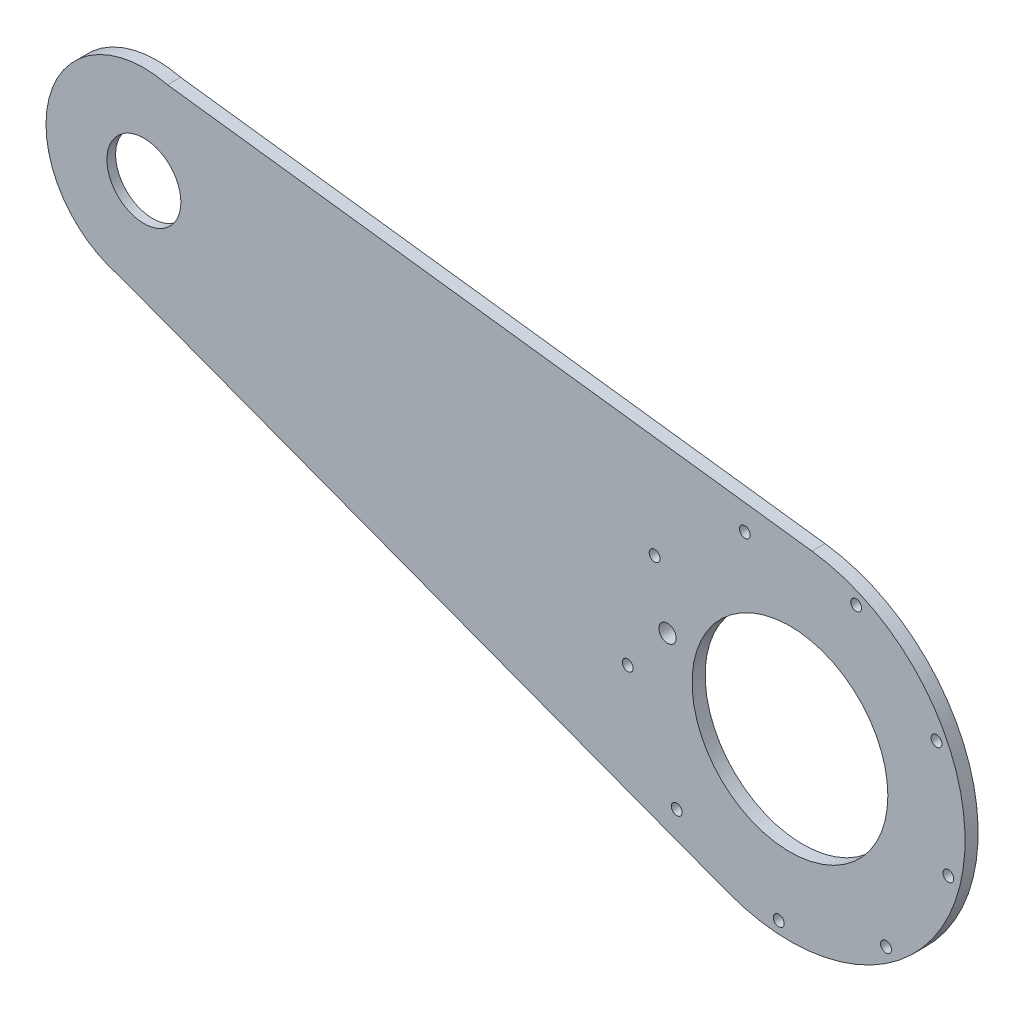
from build123d import *

# Parameters (mm, degrees)
SKETCH_2_R         = 11.5
SKETCH_2_R_2       = 22.5
SKETCH_2_R_3       = 2
EXTRUDE_1_DEPTH    = 3
EXTRUDE_START      = 1
SKETCH_2_3_R       = 11.5
SKETCH_2_3_R_2     = 8.5
EXTRUDE_2_DEPTH    = 2
HOLE_WIZARD_M3_1_D = 2.5


with BuildPart() as part:
    # 草图2 → 凸台-拉伸1 (new body)
    with BuildSketch(Plane.XY):
        with BuildLine():
            Line((-89.342878346, 100.2689352), (-237.47523438, 119.030406823))
            ThreePointArc((-237.47523438, 119.030406823), (-264.732559951, 102.612788157), (-248.314941285, 75.355462585))
            Line((-248.314941285, 75.355462585), (-108.600675895, 22.676132978))
            ThreePointArc((-108.600675895, 22.676132978), (-55.335467517, 50.642415933), (-89.342878346, 100.2689352))
        make_face()
        with Locations((-242.895087832, 97.192934704)):
            Circle(SKETCH_2_R, mode=Mode.SUBTRACT)
        with Locations((-94.40027703, 60.337932808)):
            Circle(SKETCH_2_R_2, mode=Mode.SUBTRACT)
        with Locations((-122.546352319, 67.32352005)):
            Circle(SKETCH_2_R_3, mode=Mode.SUBTRACT)
    extrude(amount=EXTRUDE_1_DEPTH)

    # 草图2<3> → 凸台-拉伸2 (add)
    with BuildSketch(Plane.XY.offset(EXTRUDE_START)):
        with Locations((-242.895087832, 97.192934704)):
            Circle(SKETCH_2_3_R)
        with Locations((-242.895087832, 97.192934704)):
            Circle(SKETCH_2_3_R_2, mode=Mode.SUBTRACT)
    extrude(amount=EXTRUDE_2_DEPTH)

    # M3 螺纹孔1 (through all)
    with Locations(Plane.XY.offset(3)):
        with Locations((-79.183536118, 94.611841193), (-60.712733566, 76.812137352), (-58.004707111, 51.303968462), (-72.326572251, 30.022892769), (-96.97696912, 22.926562105), (-120.421703236, 33.33542592), (-131.690722835, 56.379062808), (-125.511128404, 81.275098967), (-104.774420857, 96.374402389)):
            Hole(HOLE_WIZARD_M3_1_D / 2)


solid = part.part
